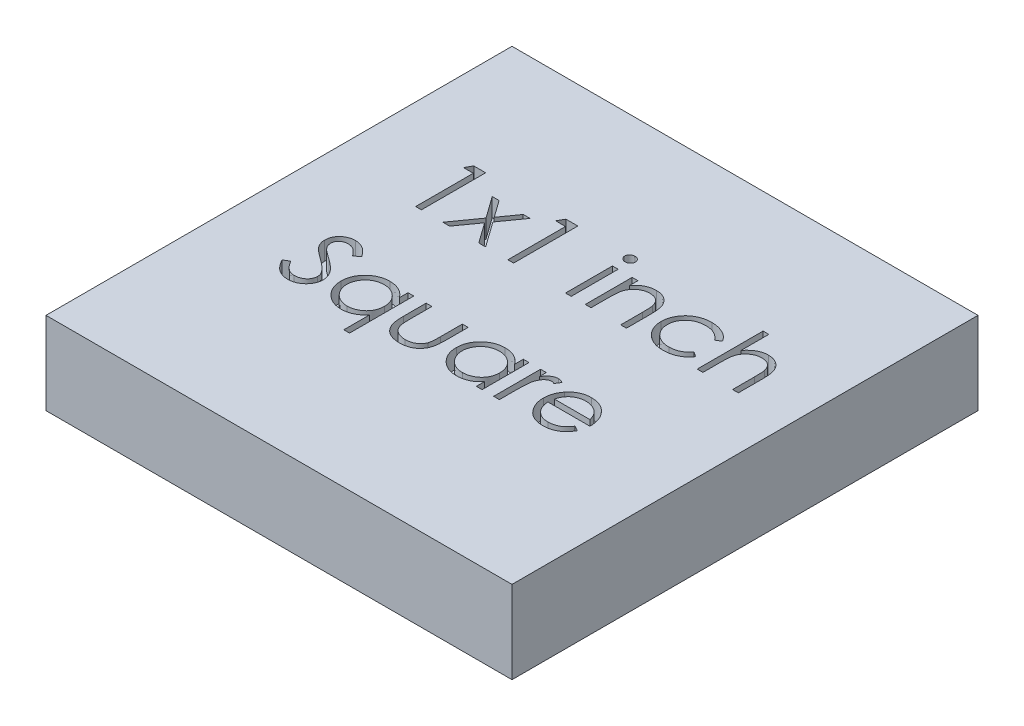
from build123d import *

# Parameters (mm, degrees)
SKETCH1_W           = 25.4
SKETCH1_H           = 25.4
BOSS_EXTRUDE1_DEPTH = 4.5
SKETCH2_W           = 0.314102564
SKETCH2_H           = 2.557692308
CUT_EXTRUDE1_DEPTH  = 1


with BuildPart() as part:
    # Sketch1 → Boss-Extrude1 (new body)
    with BuildSketch(Plane(origin=(0, 0, 0), x_dir=(1, 0, 0), z_dir=(0, 1, 0))):
        Rectangle(SKETCH1_W, SKETCH1_H)
    extrude(amount=BOSS_EXTRUDE1_DEPTH)

    # Sketch2 → Cut-Extrude1 (cut)
    # profile 1 of 14: a face of its own
    with BuildSketch(Plane(origin=(0, 4.5, 0), x_dir=(1, 0, 0), z_dir=(0, 1, 0))):
        Polygon((-8.094516721, 6.01058064), (-7.447381304, 6.01058064), (-7.447381304, 2.51058064), (-7.761483868, 2.51058064), (-7.761483868, 5.651606281), (-8.299945407, 5.651606281), align=None)
    # profile 2 of 14: a face of its own
    with BuildSketch(Plane(origin=(0, 4.5, 0), x_dir=(1, 0, 0), z_dir=(0, 1, 0))):
        Polygon((-6.146099253, 5.068272948), (-5.772401336, 5.068272948), (-5.114047971, 4.145596666), (-4.455694606, 5.068272948), (-4.081996689, 5.068272948), (-4.926848452, 3.884078236), (-3.947381304, 2.51058064), (-4.321079221, 2.51058064), (-5.114047971, 3.621858685), (-5.907016721, 2.51058064), (-6.280714638, 2.51058064), (-5.300546368, 3.884078236), align=None)
    # profile 3 of 14: a face of its own
    with BuildSketch(Plane(origin=(0, 4.5, 0), x_dir=(1, 0, 0), z_dir=(0, 1, 0))):
        Polygon((-3.068875695, 6.01058064), (-2.421740279, 6.01058064), (-2.421740279, 2.51058064), (-2.735842843, 2.51058064), (-2.735842843, 5.651606281), (-3.274304381, 5.651606281), align=None)
    # profile 4 of 14: a face of its own
    with BuildSketch(Plane(origin=(0, 4.5, 0), x_dir=(1, 0, 0), z_dir=(0, 1, 0))):
        with BuildLine():
            add(Edge.make_bspline(
                [(0.560831837, 6.145196025), (0.580323153, 6.144291872), (0.618490892, 6.142521368), (0.67368416, 6.127359891), (0.723941172, 6.101660206), (0.768518905, 6.067180525), (0.806770792, 6.026631082), (0.833551502, 5.979370113), (0.850763898, 5.928311474), (0.852842453, 5.892696385), (0.853900747, 5.874563012)],
                knots=[0, 0, 0, 0, 1.055194115, 2.066272739, 3.074728998, 4.095836921, 5.109056067, 6.073838105, 7.019297344, 8, 8, 8, 8], degree=3))
            add(Edge.make_bspline(
                [(0.853900747, 5.874563012), (0.852818587, 5.856900359), (0.850679285, 5.821983384), (0.833564797, 5.771809912), (0.806542559, 5.725205628), (0.768543434, 5.684734918), (0.723934673, 5.650274298), (0.673685887, 5.624569559), (0.618490438, 5.609409422), (0.580322999, 5.607638733), (0.560831837, 5.606734486)],
                knots=[0, 0, 0, 0, 0.96129708, 1.900370562, 2.859976407, 3.87933698, 4.906634145, 5.921202961, 6.938410037, 8, 8, 8, 8], degree=3))
            add(Edge.make_bspline(
                [(0.560831837, 5.606734486), (0.541563562, 5.607604207), (0.504060381, 5.609297003), (0.449693539, 5.624867021), (0.39986505, 5.650283094), (0.355200377, 5.684509279), (0.317970184, 5.725454177), (0.290871859, 5.77178147), (0.273796897, 5.821990625), (0.271652268, 5.856902791), (0.270567414, 5.874563012)],
                knots=[0, 0, 0, 0, 1.054934014, 2.053291228, 3.073705704, 4.106921865, 5.123545215, 6.088680038, 7.033164197, 8, 8, 8, 8], degree=3))
            add(Edge.make_bspline(
                [(0.270567414, 5.874563012), (0.2716285, 5.892693862), (0.273712541, 5.928303994), (0.290884657, 5.979399027), (0.317744465, 6.026380529), (0.355225029, 6.067406028), (0.399858489, 6.101651463), (0.449695234, 6.127062445), (0.504059934, 6.142633784), (0.54156341, 6.144326398), (0.560831837, 6.145196025)],
                knots=[0, 0, 0, 0, 0.98631895, 1.937192651, 2.907499808, 3.917963147, 4.944918757, 5.95915025, 6.951458133, 8, 8, 8, 8], degree=3))
        make_face()
    # profile 5 of 14: a face of its own
    with BuildSketch(Plane(origin=(0, 4.5, 0), x_dir=(1, 0, 0), z_dir=(0, 1, 0))):
        with Locations((0.56223408, 3.789426794)):
            Rectangle(SKETCH2_W, SKETCH2_H)
    # profile 6 of 14: a face of its own
    with BuildSketch(Plane(origin=(0, 4.5, 0), x_dir=(1, 0, 0), z_dir=(0, 1, 0))):
        with BuildLine():
            Line((1.482105875, 5.068272948), (1.796208439, 5.068272948))
            Line((1.796208439, 5.068272948), (1.796208439, 4.606934807))
            add(Edge.make_bspline(
                [(1.796208439, 4.606934807), (1.829746074, 4.64877753), (1.894827025, 4.729974793), (2.003211359, 4.836695368), (2.117755259, 4.924640593), (2.237757263, 4.994744387), (2.363380273, 5.047591013), (2.493858543, 5.085756944), (2.629973249, 5.108641773), (2.722537686, 5.111632003), (2.769365491, 5.113144743)],
                knots=[0, 0, 0, 0, 1.12780773, 2.188550248, 3.19190651, 4.159438251, 5.104880172, 6.052711206, 7.014878035, 8, 8, 8, 8], degree=3))
            add(Edge.make_bspline(
                [(2.769365491, 5.113144743), (2.816696125, 5.111399547), (2.909333592, 5.107983779), (3.044211654, 5.080967088), (3.170185048, 5.034821833), (3.286804603, 4.971609762), (3.391931817, 4.893003289), (3.484256668, 4.801425507), (3.560619916, 4.696089424), (3.611817279, 4.598366268), (3.645542926, 4.511677473), (3.666775264, 4.437430723), (3.684806245, 4.354712572), (3.700437993, 4.263772983), (3.711015105, 4.163974793), (3.719357397, 4.055727101), (3.725336091, 3.93906497), (3.725573298, 3.858378343), (3.725695619, 3.816770544)],
                knots=[0, 0, 0, 0, 1.235846778, 2.418850247, 3.575807741, 4.728682307, 5.871620074, 6.994088408, 8.11269785, 9.256955736, 9.865816715, 10.540099792, 11.271859618, 12.076849838, 12.949306005, 13.892391288, 14.913166135, 16, 16, 16, 16], degree=3))
            Line((3.725695619, 3.816770544), (3.725695619, 2.51058064))
            Line((3.725695619, 2.51058064), (3.411593055, 2.51058064))
            Line((3.411593055, 2.51058064), (3.411593055, 3.71370564))
            add(Edge.make_bspline(
                [(3.411593055, 3.71370564), (3.411399847, 3.748528085), (3.411030273, 3.815137496), (3.409864626, 3.910506519), (3.407054819, 3.996993098), (3.403106506, 4.074390465), (3.397327476, 4.142624302), (3.391304845, 4.201833578), (3.383939868, 4.251943121), (3.377376955, 4.282108203), (3.3744336, 4.29563673)],
                knots=[0, 0, 0, 0, 1.430800155, 2.736877192, 3.918605307, 4.986035426, 5.920637409, 6.731861385, 7.431261377, 8, 8, 8, 8], degree=3))
            add(Edge.make_bspline(
                [(3.3744336, 4.29563673), (3.363808068, 4.335347915), (3.343357207, 4.41177966), (3.292823224, 4.515454012), (3.229009043, 4.6036522), (3.151111194, 4.675828922), (3.059882118, 4.731999758), (2.955574976, 4.770973713), (2.839196335, 4.795349982), (2.757341952, 4.797777114), (2.714677991, 4.799042179)],
                knots=[0, 0, 0, 0, 1.084156227, 2.086665306, 3.027808233, 3.945421172, 4.874247719, 5.839848303, 6.874090471, 8, 8, 8, 8], degree=3))
            add(Edge.make_bspline(
                [(2.714677991, 4.799042179), (2.689410307, 4.798566174), (2.639406214, 4.797624173), (2.565256242, 4.788172875), (2.493332069, 4.77271442), (2.42291186, 4.751845782), (2.355404066, 4.723183513), (2.288639775, 4.690654143), (2.225133011, 4.650105931), (2.163529614, 4.604915309), (2.106216806, 4.554836102), (2.052888468, 4.501991592), (2.005350447, 4.445715988), (1.962281772, 4.38691604), (1.925103509, 4.324784202), (1.892650421, 4.259919896), (1.865114726, 4.192237747), (1.851432033, 4.145262686), (1.844585843, 4.121758525)],
                knots=[0, 0, 0, 0, 1.023777757, 2.026029729, 3.023749952, 4.003683103, 4.997618607, 5.993177895, 7.010360494, 8.046726602, 9.087585522, 10.09234134, 11.086953743, 12.070360549, 13.043493632, 14.017870808, 15.008233677, 16, 16, 16, 16], degree=3))
            add(Edge.make_bspline(
                [(1.844585843, 4.121758525), (1.840646195, 4.104503322), (1.832069786, 4.066939647), (1.822806606, 4.005295228), (1.81439903, 3.933985253), (1.807362072, 3.853092936), (1.803056655, 3.762335061), (1.798362259, 3.662099223), (1.796653198, 3.551985735), (1.796360844, 3.475324042), (1.796208439, 3.435360288)],
                knots=[0, 0, 0, 0, 0.615963638, 1.340920617, 2.168419149, 3.115676021, 4.16674242, 5.331190069, 6.6087489, 8, 8, 8, 8], degree=3))
            Line((1.796208439, 3.435360288), (1.796208439, 2.51058064))
            Line((1.796208439, 2.51058064), (1.482105875, 2.51058064))
            Line((1.482105875, 2.51058064), (1.482105875, 5.068272948))
        make_face()
    # profile 7 of 14: a face of its own
    with BuildSketch(Plane(origin=(0, 4.5, 0), x_dir=(1, 0, 0), z_dir=(0, 1, 0))):
        with BuildLine():
            Line((6.95646485, 4.513685608), (6.693544176, 4.35032423))
            add(Edge.make_bspline(
                [(6.693544176, 4.35032423), (6.664714311, 4.386152624), (6.607967616, 4.456674734), (6.50942838, 4.547684667), (6.404416965, 4.625851709), (6.291138918, 4.68955546), (6.169753118, 4.738776911), (6.040738266, 4.773607116), (5.904112761, 4.795311359), (5.810447562, 4.797778196), (5.762454433, 4.799042179)],
                knots=[0, 0, 0, 0, 1.026593902, 2.0206758, 2.988051866, 3.946915611, 4.916868779, 5.907761954, 6.927957743, 8, 8, 8, 8], degree=3))
            add(Edge.make_bspline(
                [(5.762454433, 4.799042179), (5.724095476, 4.797985337), (5.648548553, 4.795903915), (5.5376424, 4.782893421), (5.432000047, 4.759251413), (5.330959338, 4.728100456), (5.235238919, 4.686350166), (5.144588001, 4.63554041), (5.058202511, 4.57649037), (4.97858577, 4.508079824), (4.905756762, 4.433681157), (4.842657848, 4.353927461), (4.787720915, 4.27120757), (4.744614959, 4.183455828), (4.709339788, 4.092679775), (4.686133068, 3.997165919), (4.670668373, 3.898137911), (4.668899044, 3.830619572), (4.668003311, 3.796438012)],
                knots=[0, 0, 0, 0, 1.112346261, 2.190735716, 3.231507886, 4.247384806, 5.251966152, 6.253067467, 7.256802811, 8.280671706, 9.291813951, 10.270744147, 11.225547591, 12.165006084, 13.100104208, 14.043489273, 15.009504848, 16, 16, 16, 16], degree=3))
            add(Edge.make_bspline(
                [(4.668003311, 3.796438012), (4.669782563, 3.751668801), (4.673317094, 3.662733605), (4.701018554, 3.531455503), (4.746362961, 3.404531813), (4.808420812, 3.282863676), (4.886897946, 3.170269521), (4.979070509, 3.069286066), (5.084989593, 2.981870038), (5.203721923, 2.909397513), (5.332479667, 2.851136145), (5.469869771, 2.809628813), (5.614769552, 2.78457644), (5.713976299, 2.781420497), (5.764557798, 2.77981141)],
                knots=[0, 0, 0, 0, 0.966302908, 1.919585723, 2.883856336, 3.870342332, 4.860282998, 5.839159637, 6.814385684, 7.815993281, 8.834850808, 9.858348828, 10.908058873, 12, 12, 12, 12], degree=3))
            add(Edge.make_bspline(
                [(5.764557798, 2.77981141), (5.810912983, 2.781110907), (5.902013221, 2.783664764), (6.035180506, 2.805193727), (6.161960417, 2.84043736), (6.282348448, 2.889585011), (6.396124614, 2.953112526), (6.502553789, 3.031471697), (6.603753727, 3.122408298), (6.663250703, 3.192726269), (6.693544176, 3.228529358)],
                knots=[0, 0, 0, 0, 1.039848629, 2.043578496, 3.018386758, 3.987534228, 4.954977003, 5.934852016, 6.948509513, 8, 8, 8, 8], degree=3))
            Line((6.693544176, 3.228529358), (6.95646485, 3.056053397))
            add(Edge.make_bspline(
                [(6.95646485, 3.056053397), (6.940877147, 3.03316267), (6.90975348, 2.987457193), (6.857725855, 2.923013076), (6.801606023, 2.862691394), (6.741612926, 2.806573004), (6.678529917, 2.753314985), (6.610202007, 2.70546341), (6.538832396, 2.660328588), (6.463583238, 2.619715715), (6.38523254, 2.583209394), (6.30389055, 2.551818223), (6.219910737, 2.524848117), (6.133194361, 2.50341077), (6.043570463, 2.486299932), (5.951270829, 2.47494623), (5.856327247, 2.466470949), (5.792155096, 2.465965082), (5.759649946, 2.465708845)],
                knots=[0, 0, 0, 0, 0.954134338, 1.905101784, 2.851144739, 3.791306361, 4.734911809, 5.6936923, 6.663572882, 7.643865596, 8.638447847, 9.640600242, 10.646758161, 11.676244097, 12.717260333, 13.78922464, 14.880174919, 16, 16, 16, 16], degree=3))
            add(Edge.make_bspline(
                [(5.759649946, 2.465708845), (5.710039062, 2.466600125), (5.61280137, 2.46834704), (5.470478862, 2.487555515), (5.334465195, 2.516513132), (5.204806837, 2.558076866), (5.081483603, 2.611581641), (4.964610485, 2.676938556), (4.854574466, 2.754690345), (4.752463684, 2.843453115), (4.658682238, 2.939693756), (4.578156047, 3.043543674), (4.508310777, 3.151184722), (4.452223234, 3.264994248), (4.407576307, 3.38345962), (4.377071474, 3.50752986), (4.357341737, 3.636182114), (4.355058357, 3.723914996), (4.353900747, 3.76839314)],
                knots=[0, 0, 0, 0, 1.1129367, 2.181364009, 3.217532258, 4.231199276, 5.232079859, 6.230262199, 7.231623845, 8.250719726, 9.263571943, 10.242672461, 11.195837495, 12.138959767, 13.085126421, 14.0317438, 15.002148558, 16, 16, 16, 16], degree=3))
            add(Edge.make_bspline(
                [(4.353900747, 3.76839314), (4.354341763, 3.798571575), (4.355219017, 3.858601462), (4.365280945, 3.947696529), (4.378279418, 4.035605074), (4.400305155, 4.121212794), (4.425745786, 4.205818084), (4.458221318, 4.288401185), (4.496316713, 4.369345858), (4.53956866, 4.448443587), (4.588257406, 4.524393127), (4.642138639, 4.596146791), (4.699182975, 4.664566557), (4.762059087, 4.727290318), (4.828098741, 4.786826509), (4.899170317, 4.841584633), (4.974866168, 4.891725624), (5.054049491, 4.93817664), (5.136674202, 4.979536075), (5.222240873, 5.015169313), (5.310233902, 5.045621888), (5.400794046, 5.069730808), (5.493320219, 5.089948231), (5.588541557, 5.102666077), (5.686093779, 5.11165235), (5.752149802, 5.112643142), (5.785591452, 5.113144743)],
                knots=[0, 0, 0, 0, 0.990994727, 1.971252077, 2.943264845, 3.907940874, 4.872158414, 5.844625996, 6.82015047, 7.809835459, 8.804511986, 9.781214284, 10.756496977, 11.728388426, 12.696359165, 13.676225489, 14.672885716, 15.677705647, 16.690706858, 17.706033469, 18.721040654, 19.747369689, 20.783475414, 21.830280724, 22.901553713, 24, 24, 24, 24], degree=3))
            add(Edge.make_bspline(
                [(5.785591452, 5.113144743), (5.82747156, 5.112222852), (5.91102244, 5.110383678), (6.034963146, 5.094905025), (6.15707834, 5.071568609), (6.275225444, 5.036995779), (6.387971958, 4.995132124), (6.493507408, 4.948119409), (6.589347512, 4.893524806), (6.677275101, 4.833804691), (6.757454619, 4.766443786), (6.830709111, 4.690636828), (6.898540761, 4.606778349), (6.936997472, 4.544972618), (6.95646485, 4.513685608)],
                knots=[0, 0, 0, 0, 1.095225653, 2.184976855, 3.262915854, 4.344593502, 5.400796181, 6.407717688, 7.363229445, 8.282371371, 9.184954523, 10.097238608, 11.036792983, 12, 12, 12, 12], degree=3))
        make_face()
    # profile 8 of 14: a face of its own
    with BuildSketch(Plane(origin=(0, 4.5, 0), x_dir=(1, 0, 0), z_dir=(0, 1, 0))):
        with BuildLine():
            Line((7.584669978, 6.10032423), (7.898772542, 6.10032423))
            Line((7.898772542, 6.10032423), (7.898772542, 4.585200031))
            add(Edge.make_bspline(
                [(7.898772542, 4.585200031), (7.932489844, 4.627344013), (7.998139158, 4.709400506), (8.108635274, 4.816461697), (8.222106146, 4.909260318), (8.342470956, 4.983130775), (8.467521476, 5.041487319), (8.597785121, 5.082874965), (8.733286092, 5.108326062), (8.825311242, 5.11152448), (8.871929593, 5.113144743)],
                knots=[0, 0, 0, 0, 1.125788106, 2.19196713, 3.20547328, 4.180437432, 5.132270164, 6.079753143, 7.027236121, 8, 8, 8, 8], degree=3))
            add(Edge.make_bspline(
                [(8.871929593, 5.113144743), (8.919259986, 5.111399313), (9.011896981, 5.107983085), (9.146778444, 5.080969703), (9.272739319, 5.034812265), (9.389405162, 4.97164524), (9.494229859, 4.892972413), (9.587079623, 4.80214089), (9.662920422, 4.696866972), (9.714519539, 4.599610718), (9.748092947, 4.513071964), (9.769344773, 4.438835452), (9.787363971, 4.356113539), (9.803063707, 4.264948807), (9.813527289, 4.164903635), (9.821931907, 4.056429381), (9.827908361, 3.939532263), (9.828139966, 3.858612013), (9.828259721, 3.816770544)],
                knots=[0, 0, 0, 0, 1.235656852, 2.418478516, 3.575258207, 4.727955599, 5.870717718, 6.98870536, 8.107142894, 9.245821548, 9.854588956, 10.528768408, 11.260415777, 12.065282286, 12.943670737, 13.886611085, 14.907229059, 16, 16, 16, 16], degree=3))
            Line((9.828259721, 3.816770544), (9.828259721, 2.51058064))
            Line((9.828259721, 2.51058064), (9.514157157, 2.51058064))
            Line((9.514157157, 2.51058064), (9.514157157, 3.71370564))
            add(Edge.make_bspline(
                [(9.514157157, 3.71370564), (9.513966854, 3.74852831), (9.513602837, 3.81513815), (9.512399492, 3.910504259), (9.509713277, 3.997000393), (9.505372451, 4.074349345), (9.500807143, 4.142658948), (9.494523826, 4.201830003), (9.487213592, 4.251943778), (9.480644811, 4.282108407), (9.477698824, 4.29563673)],
                knots=[0, 0, 0, 0, 1.430932559, 2.737130458, 3.918967929, 4.986496826, 5.920444988, 6.731744033, 7.431208747, 8, 8, 8, 8], degree=3))
            add(Edge.make_bspline(
                [(9.477698824, 4.29563673), (9.466274579, 4.335330994), (9.444311534, 4.411642984), (9.393263557, 4.515305394), (9.329504546, 4.603690135), (9.251657284, 4.675604423), (9.16109892, 4.732015963), (9.057238956, 4.771083745), (8.941054888, 4.795331467), (8.859203416, 4.79777077), (8.816540971, 4.799042179)],
                knots=[0, 0, 0, 0, 1.090059168, 2.095632401, 3.037101401, 3.955032261, 4.878929692, 5.839099886, 6.873700383, 8, 8, 8, 8], degree=3))
            add(Edge.make_bspline(
                [(8.816540971, 4.799042179), (8.791273198, 4.798566352), (8.741268928, 4.797624704), (8.667120262, 4.788170806), (8.595191199, 4.772722087), (8.524789021, 4.751817549), (8.457405823, 4.723372012), (8.391077498, 4.690441823), (8.327683289, 4.650133568), (8.266097472, 4.6049078), (8.208779939, 4.554838041), (8.155452823, 4.501991086), (8.107914483, 4.445716121), (8.064845892, 4.386916005), (8.027667607, 4.324784212), (7.995214525, 4.259919893), (7.967678828, 4.192237748), (7.953996136, 4.145262686), (7.947149946, 4.121758525)],
                knots=[0, 0, 0, 0, 1.024319606, 2.027102035, 3.025350316, 4.005802111, 5.00026367, 5.987881639, 7.005602596, 8.042517216, 9.083927026, 10.089214625, 11.084353441, 12.06828073, 13.041928858, 14.016821737, 15.00770877, 16, 16, 16, 16], degree=3))
            add(Edge.make_bspline(
                [(7.947149946, 4.121758525), (7.943210518, 4.104737574), (7.934626022, 4.067646827), (7.925311188, 4.006472503), (7.916973392, 3.935386131), (7.909924842, 3.854495531), (7.905601756, 3.763504288), (7.900943515, 3.663033329), (7.899209501, 3.552453309), (7.898922548, 3.475557801), (7.898772542, 3.435360288)],
                knots=[0, 0, 0, 0, 0.607992626, 1.324890765, 2.152360218, 3.099583803, 4.150613268, 5.323148443, 6.60066238, 8, 8, 8, 8], degree=3))
            Line((7.898772542, 3.435360288), (7.898772542, 2.51058064))
            Line((7.898772542, 2.51058064), (7.584669978, 2.51058064))
            Line((7.584669978, 2.51058064), (7.584669978, 6.10032423))
        make_face()
    # profile 9 of 14: a face of its own
    with BuildSketch(Plane(origin=(0, 4.5, 0), x_dir=(1, 0, 0), z_dir=(0, 1, 0))):
        with BuildLine():
            Line((-8.88327874, -3.647572405), (-8.587405343, -3.47018859))
            add(Edge.make_bspline(
                [(-8.587405343, -3.47018859), (-8.559887105, -3.516252975), (-8.507163225, -3.604510559), (-8.419211866, -3.7237686), (-8.328078955, -3.825130757), (-8.233089621, -3.908007364), (-8.134823673, -3.973256251), (-8.032639619, -4.019458483), (-7.926881808, -4.048274458), (-7.854907987, -4.051774544), (-7.818975856, -4.053521924)],
                knots=[0, 0, 0, 0, 1.272034388, 2.437168799, 3.508375237, 4.49857839, 5.41946034, 6.295179144, 7.148887113, 8, 8, 8, 8], degree=3))
            add(Edge.make_bspline(
                [(-7.818975856, -4.053521924), (-7.788288995, -4.052667251), (-7.727452222, -4.050972861), (-7.637889979, -4.034692059), (-7.550908177, -4.00967993), (-7.468299539, -3.973858999), (-7.391203925, -3.930520513), (-7.323597229, -3.878174335), (-7.265151116, -3.81956813), (-7.217342001, -3.754185475), (-7.180661966, -3.683868326), (-7.152469898, -3.611692375), (-7.136824824, -3.536523807), (-7.134468071, -3.485913344), (-7.13327874, -3.460372885)],
                knots=[0, 0, 0, 0, 1.095163259, 2.171163733, 3.241058638, 4.321873601, 5.38011039, 6.391990106, 7.366004449, 8.327778327, 9.272591725, 10.192022065, 11.087607919, 12, 12, 12, 12], degree=3))
            add(Edge.make_bspline(
                [(-7.13327874, -3.460372885), (-7.134753051, -3.431232036), (-7.137750109, -3.371992947), (-7.163081589, -3.284593294), (-7.202930836, -3.198100724), (-7.23969348, -3.144599458), (-7.258779541, -3.116823206)],
                knots=[0, 0, 0, 0, 0.938893495, 1.908633276, 2.914225137, 4, 4, 4, 4], degree=3))
            add(Edge.make_bspline(
                [(-7.258779541, -3.116823206), (-7.274450156, -3.096776382), (-7.30734865, -3.054690584), (-7.363906163, -2.992045348), (-7.430272277, -2.927426929), (-7.504175832, -2.858367872), (-7.588308921, -2.788080076), (-7.680036435, -2.713211798), (-7.781700294, -2.636610221), (-7.852999791, -2.585237655), (-7.889789157, -2.558730257)],
                knots=[0, 0, 0, 0, 0.722233717, 1.516239348, 2.393582979, 3.351407094, 4.387010283, 5.505090956, 6.712668013, 8, 8, 8, 8], degree=3))
            add(Edge.make_bspline(
                [(-7.889789157, -2.558730257), (-7.926613153, -2.53250167), (-7.99701783, -2.482354607), (-8.095476412, -2.407930323), (-8.183520875, -2.339886454), (-8.260759891, -2.277582442), (-8.327159488, -2.221009837), (-8.383242899, -2.170711898), (-8.427581456, -2.125328337), (-8.452237037, -2.095886995), (-8.463306785, -2.082668558)],
                knots=[0, 0, 0, 0, 1.452282411, 2.77665338, 3.964542531, 5.026858415, 5.96415736, 6.766646006, 7.446254459, 8, 8, 8, 8], degree=3))
            add(Edge.make_bspline(
                [(-8.463306785, -2.082668558), (-8.47877933, -2.062067522), (-8.509208167, -2.021552818), (-8.549374172, -1.95822796), (-8.583513335, -1.893404695), (-8.610275667, -1.82690883), (-8.632811886, -1.759673901), (-8.647969817, -1.690822655), (-8.657461214, -1.620664037), (-8.6584332, -1.573450536), (-8.658919766, -1.549815994)],
                knots=[0, 0, 0, 0, 1.068054152, 2.10047183, 3.106115577, 4.101338837, 5.06977816, 6.043150881, 7.020423561, 8, 8, 8, 8], degree=3))
            add(Edge.make_bspline(
                [(-8.658919766, -1.549815994), (-8.657614557, -1.51278622), (-8.655032037, -1.439518156), (-8.633191519, -1.332487326), (-8.598718626, -1.230300908), (-8.550423738, -1.133970575), (-8.488166385, -1.046004594), (-8.416120411, -0.965391107), (-8.330308924, -0.897622525), (-8.236156301, -0.838410466), (-8.133099929, -0.792064541), (-8.025109026, -0.757103561), (-7.912011954, -0.737294303), (-7.835408819, -0.734451538), (-7.796539958, -0.733009103)],
                knots=[0, 0, 0, 0, 1.005424448, 1.989358655, 2.955360095, 3.929531133, 4.905563448, 5.876582895, 6.856512386, 7.866279853, 8.892233794, 9.918561126, 10.94386622, 12, 12, 12, 12], degree=3))
            add(Edge.make_bspline(
                [(-7.796539958, -0.733009103), (-7.755295858, -0.734431655), (-7.673274506, -0.737260656), (-7.552625291, -0.761858187), (-7.436464574, -0.802558859), (-7.343021309, -0.848747517), (-7.269888548, -0.894878933), (-7.214115815, -0.936898757), (-7.157598364, -0.985273866), (-7.09988031, -1.040133112), (-7.04193965, -1.101979863), (-6.982916198, -1.170390552), (-6.922671929, -1.244947108), (-6.883916069, -1.298171608), (-6.864047971, -1.32545702)],
                knots=[0, 0, 0, 0, 1.286793592, 2.559021753, 3.825965368, 5.121522368, 5.803751409, 6.523245864, 7.299691795, 8.125521123, 9.008227632, 9.944561021, 10.946284179, 12, 12, 12, 12], degree=3))
            Line((-6.864047971, -1.32545702), (-7.148002298, -1.540701411))
            add(Edge.make_bspline(
                [(-7.148002298, -1.540701411), (-7.16514823, -1.518612721), (-7.198167287, -1.476075067), (-7.248296774, -1.416503752), (-7.295545422, -1.362087272), (-7.342095822, -1.314822144), (-7.385489453, -1.272120011), (-7.427606496, -1.235560254), (-7.467840847, -1.204784659), (-7.518557758, -1.171941099), (-7.582275476, -1.139384595), (-7.662260012, -1.111835517), (-7.745846287, -1.095280455), (-7.802775919, -1.093091568), (-7.831596048, -1.091983462)],
                knots=[0, 0, 0, 0, 1.181633172, 2.275549214, 3.290209073, 4.226197932, 5.078386478, 5.862611352, 6.581680152, 7.217281963, 8.414376989, 9.595101626, 10.782541182, 12, 12, 12, 12], degree=3))
            add(Edge.make_bspline(
                [(-7.831596048, -1.091983462), (-7.86775257, -1.093195162), (-7.937477018, -1.095531811), (-8.036467254, -1.121051797), (-8.125561179, -1.161233657), (-8.202113744, -1.217548635), (-8.265850721, -1.284269628), (-8.31195618, -1.361048483), (-8.339706344, -1.445830886), (-8.343092624, -1.504972542), (-8.344817202, -1.535092437)],
                knots=[0, 0, 0, 0, 1.14458467, 2.207223713, 3.21896685, 4.227309161, 5.202851033, 6.127160689, 7.046193047, 8, 8, 8, 8], degree=3))
            add(Edge.make_bspline(
                [(-8.344817202, -1.535092437), (-8.344424075, -1.553843915), (-8.343637179, -1.591377535), (-8.332662381, -1.646828957), (-8.318563052, -1.702140296), (-8.296220421, -1.757062879), (-8.265375117, -1.812557238), (-8.224869941, -1.869578975), (-8.173856629, -1.928630684), (-8.134779617, -1.967038058), (-8.114148131, -1.987315994)],
                knots=[0, 0, 0, 0, 0.858281714, 1.717966888, 2.583508476, 3.4729293, 4.427298488, 5.488583878, 6.674047936, 8, 8, 8, 8], degree=3))
            add(Edge.make_bspline(
                [(-8.114148131, -1.987315994), (-8.106486759, -1.99415302), (-8.088285092, -2.010396228), (-8.055009166, -2.036988509), (-8.011066368, -2.069791281), (-7.957604167, -2.110378598), (-7.893636805, -2.15746006), (-7.819157249, -2.210433672), (-7.734995716, -2.271019131), (-7.6752738, -2.313376672), (-7.643695407, -2.335773526)],
                knots=[0, 0, 0, 0, 0.420754252, 0.999615792, 1.744751191, 2.668019286, 3.750313428, 4.999500688, 6.413464383, 8, 8, 8, 8], degree=3))
            add(Edge.make_bspline(
                [(-7.643695407, -2.335773526), (-7.605709494, -2.363414886), (-7.532155037, -2.416938548), (-7.427497457, -2.497354228), (-7.332603649, -2.576001996), (-7.247140446, -2.652379603), (-7.170263537, -2.725907696), (-7.102825816, -2.797470877), (-7.044140136, -2.866556449), (-6.980960918, -2.955129025), (-6.916403098, -3.063910109), (-6.860961591, -3.197188348), (-6.826003243, -3.330984668), (-6.821431728, -3.420911505), (-6.819176176, -3.465280738)],
                knots=[0, 0, 0, 0, 1.163667725, 2.253281268, 3.268753668, 4.215851969, 5.092017293, 5.902905408, 6.650798638, 7.335211899, 8.59617414, 9.77448103, 10.901945474, 12, 12, 12, 12], degree=3))
            add(Edge.make_bspline(
                [(-6.819176176, -3.465280738), (-6.819833314, -3.496659103), (-6.821134829, -3.558806487), (-6.836095743, -3.650061563), (-6.858015408, -3.738692433), (-6.891052642, -3.823603546), (-6.9313758, -3.906348308), (-6.982542048, -3.984756209), (-7.041849733, -4.060562607), (-7.109883498, -4.131746099), (-7.1843294, -4.197092295), (-7.263013095, -4.255221356), (-7.346063368, -4.303689679), (-7.433029685, -4.343240522), (-7.523932021, -4.374174039), (-7.618739805, -4.396586908), (-7.717609316, -4.410342619), (-7.784809798, -4.411770381), (-7.818975856, -4.412496283)],
                knots=[0, 0, 0, 0, 0.983748083, 1.948392443, 2.894712957, 3.844097841, 4.80183111, 5.778335162, 6.776009319, 7.81870978, 8.863265674, 9.881300176, 10.883814829, 11.87499822, 12.874611388, 13.892143829, 14.928324115, 16, 16, 16, 16], degree=3))
            add(Edge.make_bspline(
                [(-7.818975856, -4.412496283), (-7.845411199, -4.411985101), (-7.897948959, -4.410969176), (-7.97565844, -4.401987895), (-8.05179803, -4.389280792), (-8.125412312, -4.369106722), (-8.197449723, -4.344629745), (-8.267596958, -4.314491412), (-8.335888012, -4.278374211), (-8.402705595, -4.237079186), (-8.467879769, -4.189021442), (-8.530799237, -4.133047945), (-8.593528423, -4.07070244), (-8.654215819, -4.000291877), (-8.714088963, -3.922953794), (-8.771967373, -3.83796461), (-8.82904909, -3.745787257), (-8.864864558, -3.680922171), (-8.88327874, -3.647572405)],
                knots=[0, 0, 0, 0, 0.915332311, 1.819136955, 2.706846663, 3.586547465, 4.459518054, 5.340707479, 6.227863349, 7.133153174, 8.059268498, 9.028702269, 10.047606654, 11.120612155, 12.245963614, 13.433783089, 14.680604001, 16, 16, 16, 16], degree=3))
        make_face()
    # profile 10 of 14: a face of its own
    with BuildSketch(Plane(origin=(0, 4.5, 0), x_dir=(1, 0, 0), z_dir=(0, 1, 0))):
        with BuildLine():
            Line((-3.588406945, -1.765060385), (-3.588406945, -5.265060385))
            Line((-3.588406945, -5.265060385), (-3.902509509, -5.265060385))
            Line((-3.902509509, -5.265060385), (-3.902509509, -3.859311187))
            add(Edge.make_bspline(
                [(-3.902509509, -3.859311187), (-3.93797958, -3.899530454), (-4.007400556, -3.978246418), (-4.122770652, -4.082268277), (-4.24484858, -4.170170888), (-4.373541617, -4.242254627), (-4.507868586, -4.299137695), (-4.649159382, -4.337846627), (-4.795953276, -4.36377362), (-4.89635315, -4.366330206), (-4.947180984, -4.367624488)],
                knots=[0, 0, 0, 0, 1.069893489, 2.093963999, 3.093541679, 4.066938296, 5.033073547, 5.99758523, 6.986269586, 8, 8, 8, 8], degree=3))
            add(Edge.make_bspline(
                [(-4.947180984, -4.367624488), (-4.992348938, -4.366398116), (-5.081422142, -4.363979655), (-5.21245122, -4.345217352), (-5.338543469, -4.31508673), (-5.459818042, -4.27318584), (-5.575490187, -4.217605019), (-5.686550284, -4.151063771), (-5.792422976, -4.071822941), (-5.891494515, -3.981234912), (-5.982726515, -3.882839925), (-6.062787788, -3.777894378), (-6.129540868, -3.666852074), (-6.185360948, -3.551118921), (-6.228357293, -3.429804001), (-6.258330927, -3.303326833), (-6.277071374, -3.17183696), (-6.279488834, -3.082297436), (-6.280714638, -3.036895321)],
                knots=[0, 0, 0, 0, 1.033919861, 2.038935746, 3.024066025, 3.998881131, 4.97069526, 5.957263378, 6.95902576, 7.993208707, 9.027059324, 10.027763471, 11.009749337, 11.988697705, 12.965288445, 13.950418724, 14.960734635, 16, 16, 16, 16], degree=3))
            add(Edge.make_bspline(
                [(-6.280714638, -3.036895321), (-6.279461666, -2.992431618), (-6.276984609, -2.904529274), (-6.25853139, -2.775250576), (-6.227500381, -2.650732316), (-6.183952533, -2.531375372), (-6.128110578, -2.417035322), (-6.060182491, -2.307631297), (-5.980163367, -2.2028619), (-5.88791096, -2.105190673), (-5.787976189, -2.014970059), (-5.681067458, -1.936561013), (-5.569844177, -1.868844164), (-5.452581167, -1.815190688), (-5.331014062, -1.771781584), (-5.204060616, -1.741748616), (-5.072249037, -1.724051294), (-4.982758545, -1.72148853), (-4.937365279, -1.72018859)],
                knots=[0, 0, 0, 0, 1.020392517, 2.01726096, 2.990465484, 3.961182959, 4.928053699, 5.906110375, 6.912531644, 7.948652711, 8.985773172, 9.998621852, 10.987621588, 11.969261332, 12.953316658, 13.946091881, 14.958173133, 16, 16, 16, 16], degree=3))
            add(Edge.make_bspline(
                [(-4.937365279, -1.72018859), (-4.88516542, -1.721626342), (-4.78280396, -1.724445705), (-4.63307595, -1.747908432), (-4.491431472, -1.787546899), (-4.35677712, -1.841464397), (-4.229596434, -1.913113127), (-4.11109345, -2.003493088), (-4.000027967, -2.112034275), (-3.935647675, -2.195404719), (-3.902509509, -2.238317597)],
                knots=[0, 0, 0, 0, 1.038897134, 2.037228247, 3.008116434, 3.962042015, 4.918381754, 5.904844433, 6.921570401, 8, 8, 8, 8], degree=3))
            Line((-3.902509509, -2.238317597), (-3.902509509, -1.765060385))
            Line((-3.902509509, -1.765060385), (-3.588406945, -1.765060385))
        make_face()
        with BuildLine():
            add(Edge.make_bspline(
                [(-4.933158548, -2.034291155), (-4.979072886, -2.035924792), (-5.069700486, -2.039149333), (-5.202744488, -2.064322829), (-5.330057902, -2.106207423), (-5.451003976, -2.163489324), (-5.563672193, -2.235518061), (-5.664365864, -2.322639444), (-5.753908565, -2.422476458), (-5.829216829, -2.534578569), (-5.890607326, -2.65475666), (-5.933774358, -2.780381098), (-5.962243605, -2.909186075), (-5.965152126, -2.996548761), (-5.966612074, -3.04040093)],
                knots=[0, 0, 0, 0, 1.031046209, 2.035121221, 3.029706178, 4.034933723, 5.034054252, 6.02443088, 7.017295772, 8.038157696, 9.050218397, 10.03989886, 11.016116709, 12, 12, 12, 12], degree=3))
            add(Edge.make_bspline(
                [(-5.966612074, -3.04040093), (-5.96474718, -3.083991037), (-5.961024703, -3.171000393), (-5.934274009, -3.29998097), (-5.889394135, -3.425635012), (-5.828152073, -3.546896006), (-5.751465448, -3.659480106), (-5.662576795, -3.761220229), (-5.560626514, -3.848709817), (-5.447699007, -3.92194739), (-5.327091037, -3.981109911), (-5.200257105, -4.022275551), (-5.069581467, -4.048853331), (-4.980729133, -4.051957808), (-4.935963035, -4.053521924)],
                knots=[0, 0, 0, 0, 0.979072187, 1.954306742, 2.945804271, 3.96968567, 4.997920485, 5.998718438, 6.996577872, 8.005894225, 9.015743152, 10.005417472, 10.995077863, 12, 12, 12, 12], degree=3))
            add(Edge.make_bspline(
                [(-4.935963035, -4.053521924), (-4.890516532, -4.05186196), (-4.800127946, -4.048560456), (-4.666689238, -4.023279191), (-4.537194275, -3.981510393), (-4.413407047, -3.923611266), (-4.298090916, -3.85185391), (-4.194593038, -3.767846819), (-4.10707707, -3.670143635), (-4.03288446, -3.562767182), (-3.974709043, -3.445055185), (-3.932332984, -3.319720995), (-3.907279078, -3.186760246), (-3.904121349, -3.09589632), (-3.902509509, -3.049515514)],
                knots=[0, 0, 0, 0, 1.01762866, 2.023962475, 3.030623092, 4.058876274, 5.077231937, 6.066672613, 7.034107872, 8.005628644, 8.981990164, 9.965428785, 10.961468474, 12, 12, 12, 12], degree=3))
            add(Edge.make_bspline(
                [(-3.902509509, -3.049515514), (-3.903469166, -3.014177683), (-3.905358073, -2.94462165), (-3.919788643, -2.842494132), (-3.942743569, -2.744760406), (-3.975089739, -2.651317717), (-4.017581024, -2.562682702), (-4.068828789, -2.478218941), (-4.129734239, -2.39836573), (-4.199316935, -2.324222659), (-4.275482138, -2.256596197), (-4.356076678, -2.196231956), (-4.442055425, -2.146643183), (-4.531972462, -2.105601912), (-4.625983797, -2.072942762), (-4.724854417, -2.051155068), (-4.827533404, -2.036194747), (-4.897579459, -2.034932366), (-4.933158548, -2.034291155)],
                knots=[0, 0, 0, 0, 1.050140795, 2.067009409, 3.05949893, 4.030605086, 5.00011959, 5.97591094, 6.962425594, 7.979863591, 8.993523472, 9.986985069, 10.967611495, 11.937549037, 12.921786183, 13.919465291, 14.943216303, 16, 16, 16, 16], degree=3))
        make_face(mode=Mode.SUBTRACT)
    # profile 11 of 14: a face of its own
    with BuildSketch(Plane(origin=(0, 4.5, 0), x_dir=(1, 0, 0), z_dir=(0, 1, 0))):
        with BuildLine():
            Line((-2.915330022, -1.765060385), (-2.601227458, -1.765060385))
            Line((-2.601227458, -1.765060385), (-2.601227458, -2.951358462))
            add(Edge.make_bspline(
                [(-2.601227458, -2.951358462), (-2.601085553, -2.986181211), (-2.600814096, -3.0527955), (-2.598973155, -3.148650686), (-2.594643061, -3.236067399), (-2.589229237, -3.315096136), (-2.582267101, -3.385723527), (-2.57398374, -3.447702884), (-2.564725318, -3.501737068), (-2.555662605, -3.534280424), (-2.551447811, -3.549415353)],
                knots=[0, 0, 0, 0, 1.388932606, 2.656963016, 3.823490214, 4.879454478, 5.816252168, 6.653371382, 7.373723809, 8, 8, 8, 8], degree=3))
            add(Edge.make_bspline(
                [(-2.551447811, -3.549415353), (-2.544686356, -3.568438224), (-2.531304015, -3.606088485), (-2.507030531, -3.660477491), (-2.477002194, -3.710852773), (-2.444142366, -3.759156846), (-2.406242959, -3.803958833), (-2.363783488, -3.845183076), (-2.318185251, -3.884387167), (-2.250430227, -3.930771959), (-2.157770961, -3.98048729), (-2.036118206, -4.023383108), (-1.90421398, -4.049018928), (-1.813049261, -4.051993183), (-1.7661914, -4.053521924)],
                knots=[0, 0, 0, 0, 0.725840625, 1.436591201, 2.137033971, 2.831655856, 3.53531722, 4.242432219, 4.957935707, 5.694543706, 7.190802206, 8.724350549, 10.316345118, 12, 12, 12, 12], degree=3))
            add(Edge.make_bspline(
                [(-1.7661914, -4.053521924), (-1.719337893, -4.051960675), (-1.628685024, -4.048939948), (-1.498230055, -4.024156409), (-1.378978641, -3.98275072), (-1.272127689, -3.924943309), (-1.178161849, -3.854201246), (-1.09985743, -3.771192437), (-1.035250176, -3.67854305), (-1.007040755, -3.609418771), (-0.992854061, -3.574655738)],
                knots=[0, 0, 0, 0, 1.157059328, 2.238695713, 3.266970494, 4.264342957, 5.228770407, 6.160125903, 7.074715775, 8, 8, 8, 8], degree=3))
            add(Edge.make_bspline(
                [(-0.992854061, -3.574655738), (-0.988659831, -3.560689439), (-0.979387412, -3.529813364), (-0.969425061, -3.477433615), (-0.960450599, -3.414969011), (-0.952787423, -3.342010802), (-0.94732226, -3.25874965), (-0.944376234, -3.165211574), (-0.941047959, -3.061690213), (-0.940997442, -2.989222454), (-0.940971048, -2.951358462)],
                knots=[0, 0, 0, 0, 0.557542046, 1.232589297, 2.036731608, 2.971723315, 4.038036528, 5.22795436, 6.551621927, 8, 8, 8, 8], degree=3))
            Line((-0.940971048, -2.951358462), (-0.940971048, -1.765060385))
            Line((-0.940971048, -1.765060385), (-0.626868484, -1.765060385))
            Line((-0.626868484, -1.765060385), (-0.626868484, -3.010252693))
            add(Edge.make_bspline(
                [(-0.626868484, -3.010252693), (-0.627310179, -3.052559865), (-0.628167127, -3.134641564), (-0.63367447, -3.253925676), (-0.643124083, -3.365087921), (-0.657466768, -3.468187141), (-0.674332443, -3.563144622), (-0.696088716, -3.650082068), (-0.722066953, -3.728731622), (-0.751372468, -3.800473399), (-0.785994336, -3.865520293), (-0.822821356, -3.92725611), (-0.865346128, -3.984149045), (-0.910116363, -4.039031182), (-0.959918018, -4.08917271), (-1.013817877, -4.135724186), (-1.071057297, -4.179397217), (-1.132906495, -4.218488497), (-1.198462558, -4.253705142), (-1.267806415, -4.28492122), (-1.341787413, -4.309623797), (-1.41945105, -4.330934463), (-1.50117783, -4.347648932), (-1.586888963, -4.359435499), (-1.676555579, -4.36666083), (-1.737665039, -4.367297875), (-1.768995888, -4.367624488)],
                knots=[0, 0, 0, 0, 1.493040784, 2.896703357, 4.213163133, 5.428574705, 6.569057535, 7.615249723, 8.588095153, 9.490268104, 10.346124644, 11.18633936, 12.024365274, 12.850166724, 13.684164916, 14.514361689, 15.362232829, 16.222528818, 17.093394965, 17.986930858, 18.902426812, 19.842810585, 20.827885679, 21.843828298, 22.894529745, 24, 24, 24, 24], degree=3))
            add(Edge.make_bspline(
                [(-1.768995888, -4.367624488), (-1.800092402, -4.367284781), (-1.861199947, -4.366617225), (-1.950871191, -4.359475417), (-2.036819797, -4.347667246), (-2.118740196, -4.330812029), (-2.196714593, -4.309772959), (-2.271058833, -4.284769423), (-2.340902396, -4.253688942), (-2.4070844, -4.218711384), (-2.469086788, -4.179146109), (-2.527195366, -4.135778069), (-2.581332219, -4.088672006), (-2.631509287, -4.038024649), (-2.677022263, -3.983207713), (-2.718438305, -3.924662152), (-2.75639501, -3.862968064), (-2.790747801, -3.796904901), (-2.820259556, -3.724332892), (-2.846314802, -3.644035794), (-2.86762544, -3.555133278), (-2.884967909, -3.457701349), (-2.898919349, -3.352206308), (-2.908605492, -3.238037892), (-2.914021322, -3.1154742), (-2.914884384, -3.03082431), (-2.915330022, -2.987115674)],
                knots=[0, 0, 0, 0, 1.083640291, 2.129454052, 3.13281866, 4.105697902, 5.042300162, 5.946461698, 6.836384745, 7.703652036, 8.553297018, 9.397182691, 10.228592656, 11.052265423, 11.879314572, 12.708807002, 13.549817954, 14.402308542, 15.300838682, 16.27712199, 17.341985831, 18.484375296, 19.725102775, 21.0496083, 22.476576903, 24, 24, 24, 24], degree=3))
            Line((-2.915330022, -2.987115674), (-2.915330022, -1.765060385))
        make_face()
    # profile 12 of 14: a face of its own
    with BuildSketch(Plane(origin=(0, 4.5, 0), x_dir=(1, 0, 0), z_dir=(0, 1, 0))):
        with BuildLine():
            Line((2.693644337, -1.765060385), (2.693644337, -4.322752693))
            Line((2.693644337, -4.322752693), (2.379541773, -4.322752693))
            Line((2.379541773, -4.322752693), (2.379541773, -3.88034484))
            add(Edge.make_bspline(
                [(2.379541773, -3.88034484), (2.344122982, -3.920384434), (2.275002767, -3.998522206), (2.159561649, -4.100604378), (2.037193471, -4.1849827), (1.90849215, -4.253132615), (1.773573906, -4.304324672), (1.632737819, -4.340710831), (1.485926438, -4.364104666), (1.385674083, -4.366440688), (1.334870298, -4.367624488)],
                knots=[0, 0, 0, 0, 1.074387032, 2.096679803, 3.090159297, 4.057316773, 5.018401886, 5.985159533, 6.978961417, 8, 8, 8, 8], degree=3))
            add(Edge.make_bspline(
                [(1.334870298, -4.367624488), (1.289702344, -4.366398116), (1.20062914, -4.363979655), (1.069600062, -4.345217352), (0.943507813, -4.31508673), (0.82223324, -4.27318584), (0.706561095, -4.217605019), (0.595500998, -4.151063771), (0.489628306, -4.071822941), (0.390556767, -3.981234912), (0.299324767, -3.882839925), (0.219263494, -3.777894378), (0.152510414, -3.666852074), (0.096690334, -3.551118921), (0.053693989, -3.429804001), (0.023720355, -3.303326833), (0.004979908, -3.17183696), (0.002562448, -3.082297436), (0.001336644, -3.036895321)],
                knots=[0, 0, 0, 0, 1.033919861, 2.038935746, 3.024066025, 3.998881131, 4.97069526, 5.957263378, 6.95902576, 7.993208707, 9.027059324, 10.027763471, 11.009749337, 11.988697705, 12.965288445, 13.950418724, 14.960734635, 16, 16, 16, 16], degree=3))
            add(Edge.make_bspline(
                [(0.001336644, -3.036895321), (0.002589616, -2.992431618), (0.005066673, -2.904529274), (0.023519893, -2.775250576), (0.054550901, -2.650732316), (0.098098749, -2.531375372), (0.153940704, -2.417035322), (0.221868791, -2.307631297), (0.301887916, -2.2028619), (0.394140323, -2.105190673), (0.494075093, -2.014970059), (0.600983824, -1.936561013), (0.712207105, -1.868844164), (0.829470115, -1.815190688), (0.95103722, -1.771781584), (1.077990666, -1.741748616), (1.209802245, -1.724051294), (1.299292737, -1.72148853), (1.344686003, -1.72018859)],
                knots=[0, 0, 0, 0, 1.020392517, 2.01726096, 2.990465484, 3.961182959, 4.928053699, 5.906110375, 6.912531644, 7.948652711, 8.985773172, 9.998621852, 10.987621588, 11.969261332, 12.953316658, 13.946091881, 14.958173133, 16, 16, 16, 16], degree=3))
            add(Edge.make_bspline(
                [(1.344686003, -1.72018859), (1.396885862, -1.721626342), (1.499247322, -1.724445705), (1.648975332, -1.747908432), (1.79061981, -1.787546899), (1.925274162, -1.841464397), (2.052454848, -1.913113127), (2.170957832, -2.003493088), (2.282023315, -2.112034275), (2.346403607, -2.195404719), (2.379541773, -2.238317597)],
                knots=[0, 0, 0, 0, 1.038897134, 2.037228247, 3.008116434, 3.962042015, 4.918381754, 5.904844433, 6.921570401, 8, 8, 8, 8], degree=3))
            Line((2.379541773, -2.238317597), (2.379541773, -1.765060385))
            Line((2.379541773, -1.765060385), (2.693644337, -1.765060385))
        make_face()
        with BuildLine():
            add(Edge.make_bspline(
                [(1.348892734, -2.034291155), (1.302978396, -2.035924792), (1.212350796, -2.039149333), (1.079306794, -2.064322829), (0.95199338, -2.106207423), (0.831047306, -2.163489324), (0.718379089, -2.235518061), (0.617685418, -2.322639444), (0.528142717, -2.422476458), (0.452834453, -2.534578569), (0.391443956, -2.65475666), (0.348276924, -2.780381098), (0.319807677, -2.909186075), (0.316899156, -2.996548761), (0.315439209, -3.04040093)],
                knots=[0, 0, 0, 0, 1.031046209, 2.035121221, 3.029706178, 4.034933723, 5.034054252, 6.02443088, 7.017295772, 8.038157696, 9.050218397, 10.03989886, 11.016116709, 12, 12, 12, 12], degree=3))
            add(Edge.make_bspline(
                [(0.315439209, -3.04040093), (0.317304102, -3.083991037), (0.321026579, -3.171000393), (0.347777273, -3.29998097), (0.392657147, -3.425635012), (0.453899209, -3.546896006), (0.530585834, -3.659480106), (0.619474487, -3.761220229), (0.721424768, -3.848709817), (0.834352275, -3.92194739), (0.954960245, -3.981109911), (1.081794177, -4.022275551), (1.212469815, -4.048853331), (1.301322149, -4.051957808), (1.346088247, -4.053521924)],
                knots=[0, 0, 0, 0, 0.979072187, 1.954306742, 2.945804271, 3.96968567, 4.997920485, 5.998718438, 6.996577872, 8.005894225, 9.015743152, 10.005417472, 10.995077863, 12, 12, 12, 12], degree=3))
            add(Edge.make_bspline(
                [(1.346088247, -4.053521924), (1.39153475, -4.05186196), (1.481923336, -4.048560456), (1.615362044, -4.023279191), (1.744857007, -3.981510393), (1.868644235, -3.923611266), (1.983960366, -3.85185391), (2.087458244, -3.767846819), (2.174974212, -3.670143635), (2.249166822, -3.562767182), (2.307342239, -3.445055185), (2.349718298, -3.319720995), (2.374772204, -3.186760246), (2.377929933, -3.09589632), (2.379541773, -3.049515514)],
                knots=[0, 0, 0, 0, 1.01762866, 2.023962475, 3.030623092, 4.058876274, 5.077231937, 6.066672613, 7.034107872, 8.005628644, 8.981990164, 9.965428785, 10.961468474, 12, 12, 12, 12], degree=3))
            add(Edge.make_bspline(
                [(2.379541773, -3.049515514), (2.378582116, -3.014177683), (2.376693209, -2.94462165), (2.362262639, -2.842494132), (2.339307713, -2.744760406), (2.306961543, -2.651317717), (2.264470258, -2.562682702), (2.213222493, -2.478218941), (2.152317043, -2.39836573), (2.082734347, -2.324222659), (2.006569144, -2.256596197), (1.925974604, -2.196231956), (1.839995857, -2.146643183), (1.75007882, -2.105601912), (1.656067485, -2.072942762), (1.557196865, -2.051155068), (1.454517878, -2.036194747), (1.384471823, -2.034932366), (1.348892734, -2.034291155)],
                knots=[0, 0, 0, 0, 1.050140795, 2.067009409, 3.05949893, 4.030605086, 5.00011959, 5.97591094, 6.962425594, 7.979863591, 8.993523472, 9.986985069, 10.967611495, 11.937549037, 12.921786183, 13.919465291, 14.943216303, 16, 16, 16, 16], degree=3))
        make_face(mode=Mode.SUBTRACT)
    # profile 13 of 14: a face of its own
    with BuildSketch(Plane(origin=(0, 4.5, 0), x_dir=(1, 0, 0), z_dir=(0, 1, 0))):
        with BuildLine():
            Line((3.321849465, -1.765060385), (3.635952029, -1.765060385))
            Line((3.635952029, -1.765060385), (3.635952029, -2.141562789))
            add(Edge.make_bspline(
                [(3.635952029, -2.141562789), (3.659140788, -2.106506961), (3.703489109, -2.039462962), (3.777202038, -1.950793661), (3.852705369, -1.877378614), (3.930360557, -1.818875095), (4.010738657, -1.775061976), (4.092075608, -1.742968941), (4.175651078, -1.723991626), (4.231813002, -1.721457967), (4.259950426, -1.72018859)],
                knots=[0, 0, 0, 0, 1.2804753, 2.448899062, 3.506932113, 4.484331642, 5.4025378, 6.288909075, 7.142734305, 8, 8, 8, 8], degree=3))
            add(Edge.make_bspline(
                [(4.259950426, -1.72018859), (4.281776753, -1.721379117), (4.326685838, -1.723828703), (4.394668428, -1.741039528), (4.46471188, -1.76851755), (4.509854267, -1.794357773), (4.533387926, -1.807828815)],
                knots=[0, 0, 0, 0, 0.901110191, 1.854092781, 2.881294221, 4, 4, 4, 4], degree=3))
            Line((4.533387926, -1.807828815), (4.360911965, -2.079864071))
            add(Edge.make_bspline(
                [(4.360911965, -2.079864071), (4.345802944, -2.073123805), (4.317123129, -2.06032949), (4.275168563, -2.04518748), (4.236487226, -2.036271564), (4.211843668, -2.034920846), (4.200355074, -2.034291155)],
                knots=[0, 0, 0, 0, 1.180555205, 2.24091978, 3.179933427, 4, 4, 4, 4], degree=3))
            add(Edge.make_bspline(
                [(4.200355074, -2.034291155), (4.17514934, -2.035971192), (4.12373695, -2.039397981), (4.048252451, -2.066336789), (3.975005246, -2.109862029), (3.916833583, -2.158133141), (3.87179133, -2.204680938), (3.839651105, -2.245329341), (3.810168358, -2.290907972), (3.781998137, -2.340637656), (3.756331843, -2.395367502), (3.732377174, -2.454550716), (3.710718311, -2.518255845), (3.698368067, -2.562638365), (3.692041773, -2.585372885)],
                knots=[0, 0, 0, 0, 1.125678352, 2.296057538, 3.5422874, 4.923748041, 5.663163013, 6.437101912, 7.23742474, 8.08941207, 8.991984279, 9.93940061, 10.944477711, 12, 12, 12, 12], degree=3))
            add(Edge.make_bspline(
                [(3.692041773, -2.585372885), (3.687309379, -2.605650059), (3.676827488, -2.650562458), (3.66663595, -2.725910982), (3.656566432, -2.814934641), (3.649469813, -2.917881234), (3.642891771, -3.034493678), (3.639181689, -3.164949624), (3.636078549, -3.309382975), (3.635995482, -3.410357328), (3.635952029, -3.463177373)],
                knots=[0, 0, 0, 0, 0.566838948, 1.255505196, 2.06880316, 3.007127437, 4.065329342, 5.249902469, 6.561414163, 8, 8, 8, 8], degree=3))
            Line((3.635952029, -3.463177373), (3.635952029, -4.322752693))
            Line((3.635952029, -4.322752693), (3.321849465, -4.322752693))
            Line((3.321849465, -4.322752693), (3.321849465, -1.765060385))
        make_face()
    # profile 14 of 14: a face of its own
    with BuildSketch(Plane(origin=(0, 4.5, 0), x_dir=(1, 0, 0), z_dir=(0, 1, 0))):
        with BuildLine():
            Line((6.946649144, -3.515060385), (7.225695619, -3.66159484))
            add(Edge.make_bspline(
                [(7.225695619, -3.66159484), (7.203459024, -3.701038172), (7.160195415, -3.777779275), (7.085794667, -3.883211135), (7.007802595, -3.978058851), (6.922698627, -4.059788505), (6.833028948, -4.13103989), (6.738296293, -4.193377715), (6.638007475, -4.246496235), (6.53215775, -4.291248763), (6.419858199, -4.325658257), (6.300836683, -4.349962478), (6.174865187, -4.364985747), (6.088519008, -4.366730888), (6.044305394, -4.367624488)],
                knots=[0, 0, 0, 0, 1.120438281, 2.179929193, 3.190490725, 4.156257408, 5.095198341, 6.022838206, 6.959905092, 7.901321166, 8.864066838, 9.862729781, 10.905609505, 12, 12, 12, 12], degree=3))
            add(Edge.make_bspline(
                [(6.044305394, -4.367624488), (5.995163417, -4.366477313), (5.899301655, -4.364239506), (5.759761908, -4.344947041), (5.62838249, -4.313474683), (5.505170786, -4.269509141), (5.390428534, -4.212081817), (5.283927679, -4.142122335), (5.185108153, -4.059990081), (5.097083944, -3.964973637), (5.017840061, -3.86329168), (4.947914241, -3.757335795), (4.88945681, -3.647372571), (4.8419042, -3.534102047), (4.803499335, -3.418238153), (4.776732631, -3.298726686), (4.761302883, -3.175891102), (4.758938438, -3.092793766), (4.757746901, -3.050917757)],
                knots=[0, 0, 0, 0, 1.145258523, 2.234067595, 3.276747158, 4.290159414, 5.277019952, 6.260822364, 7.254936242, 8.264827045, 9.274100331, 10.257902744, 11.220704747, 12.172965371, 13.118907548, 14.062713208, 15.023725156, 16, 16, 16, 16], degree=3))
            add(Edge.make_bspline(
                [(4.757746901, -3.050917757), (4.758806042, -3.011622927), (4.76090512, -2.933745762), (4.774135908, -2.818480218), (4.797584201, -2.706451765), (4.829760525, -2.597567317), (4.871311771, -2.492009183), (4.92214399, -2.389713119), (4.982336368, -2.29078798), (5.028809042, -2.228384846), (5.052218055, -2.196951411)],
                knots=[0, 0, 0, 0, 1.024358464, 2.0301432, 3.019427413, 4.004406732, 4.986367066, 5.972626655, 6.978780325, 8, 8, 8, 8], degree=3))
            add(Edge.make_bspline(
                [(5.052218055, -2.196951411), (5.083925737, -2.159082541), (5.146336684, -2.08454439), (5.251893039, -1.986606065), (5.366193236, -1.90456229), (5.487804862, -1.836555153), (5.618141336, -1.784881506), (5.755450627, -1.746373924), (5.901296213, -1.724795913), (6.001001434, -1.721748079), (6.052017734, -1.72018859)],
                knots=[0, 0, 0, 0, 1.030682036, 2.02871468, 2.997146059, 3.962720338, 4.930598197, 5.918074684, 6.934738563, 8, 8, 8, 8], degree=3))
            add(Edge.make_bspline(
                [(6.052017734, -1.72018859), (6.104465339, -1.721542639), (6.207355585, -1.724198975), (6.357387706, -1.748825308), (6.499348423, -1.787877863), (6.633180927, -1.843031653), (6.758898788, -1.914191205), (6.875684838, -2.002333046), (6.98553635, -2.104751134), (7.049444929, -2.183514343), (7.081965651, -2.223594039)],
                knots=[0, 0, 0, 0, 1.056321875, 2.072262726, 3.055038591, 4.01806755, 4.982017516, 5.957941055, 6.960871419, 8, 8, 8, 8], degree=3))
            add(Edge.make_bspline(
                [(7.081965651, -2.223594039), (7.104092589, -2.253797621), (7.148199182, -2.314003739), (7.203446282, -2.412174896), (7.251403677, -2.514885491), (7.289736638, -2.623795788), (7.320776139, -2.737615368), (7.343232958, -2.857157913), (7.356402577, -2.982387824), (7.358991274, -3.06771438), (7.360311003, -3.111214232)],
                knots=[0, 0, 0, 0, 0.94817472, 1.890038105, 2.849395472, 3.817997239, 4.812318967, 5.836947057, 6.897266129, 8, 8, 8, 8], degree=3))
            Line((7.360311003, -3.111214232), (5.071849465, -3.111214232))
            add(Edge.make_bspline(
                [(5.071849465, -3.111214232), (5.073389071, -3.144914696), (5.076416645, -3.2111853), (5.090531789, -3.308156083), (5.112780562, -3.400529425), (5.144049625, -3.487612467), (5.18191647, -3.570542594), (5.228302187, -3.648704631), (5.283641741, -3.721742561), (5.34536744, -3.790309699), (5.414074536, -3.85137046), (5.486357283, -3.906022236), (5.563250848, -3.951827833), (5.644148931, -3.989007723), (5.728920716, -4.018114039), (5.817592912, -4.037981859), (5.909991028, -4.051288966), (5.972976762, -4.052768632), (6.005042574, -4.053521924)],
                knots=[0, 0, 0, 0, 1.094153842, 2.151609401, 3.174256925, 4.172055639, 5.149267565, 6.128595816, 7.11444997, 8.118368179, 9.117203808, 10.09244225, 11.054858984, 12.015122123, 12.976791628, 13.957293641, 14.960065497, 16, 16, 16, 16], degree=3))
            add(Edge.make_bspline(
                [(6.005042574, -4.053521924), (6.036393722, -4.052913867), (6.098600412, -4.051707366), (6.19124127, -4.039975455), (6.282380797, -4.02100518), (6.37164178, -3.995115189), (6.457212626, -3.963538337), (6.536458176, -3.92543548), (6.609338392, -3.883285733), (6.677455359, -3.835076058), (6.743526352, -3.776067871), (6.809068838, -3.70243215), (6.879345492, -3.615344622), (6.923335085, -3.549798956), (6.946649144, -3.515060385)],
                knots=[0, 0, 0, 0, 0.99110716, 1.966546729, 2.947904876, 3.932708344, 4.903319531, 5.828989031, 6.710028674, 7.56322171, 8.463672341, 9.504779593, 10.677557249, 12, 12, 12, 12], degree=3))
        make_face()
        with BuildLine():
            add(Edge.make_bspline(
                [(7.046208439, -2.797111667), (7.034711815, -2.755448794), (7.012584513, -2.675261173), (6.966348149, -2.564220283), (6.914276608, -2.465532382), (6.852654877, -2.379952749), (6.782836151, -2.303949236), (6.702190968, -2.23753065), (6.611755075, -2.178113199), (6.511995934, -2.1279607), (6.406354149, -2.085270841), (6.295747957, -2.056645725), (6.182890169, -2.037036183), (6.106555883, -2.035210075), (6.068143535, -2.034291155)],
                knots=[0, 0, 0, 0, 1.154881502, 2.222775134, 3.210006277, 4.132804581, 5.035138423, 5.962687519, 6.919655026, 7.923214229, 8.944639381, 9.960483929, 10.97369054, 12, 12, 12, 12], degree=3))
            add(Edge.make_bspline(
                [(6.068143535, -2.034291155), (6.036794097, -2.034902826), (5.974822848, -2.036111972), (5.88352178, -2.047582102), (5.795842081, -2.066541946), (5.711136793, -2.092506903), (5.630515925, -2.127115505), (5.552321157, -2.167698732), (5.47854076, -2.217240316), (5.432399465, -2.254999171), (5.409089048, -2.274074808)],
                knots=[0, 0, 0, 0, 1.04873581, 2.073130211, 3.073294108, 4.04793562, 5.032784715, 6.005352987, 6.992311501, 8, 8, 8, 8], degree=3))
            add(Edge.make_bspline(
                [(5.409089048, -2.274074808), (5.392395766, -2.289169124), (5.358612632, -2.31971634), (5.313472111, -2.372345547), (5.270251638, -2.429097109), (5.230917985, -2.492142233), (5.194840399, -2.560763012), (5.161080422, -2.634380648), (5.130694009, -2.713553778), (5.113597899, -2.768726217), (5.104802189, -2.797111667)],
                knots=[0, 0, 0, 0, 0.879870761, 1.780643979, 2.707998968, 3.669668524, 4.684282772, 5.740141944, 6.837334558, 8, 8, 8, 8], degree=3))
            Line((5.104802189, -2.797111667), (7.046208439, -2.797111667))
        make_face(mode=Mode.SUBTRACT)
    extrude(amount=-CUT_EXTRUDE1_DEPTH, mode=Mode.SUBTRACT)


solid = part.part
